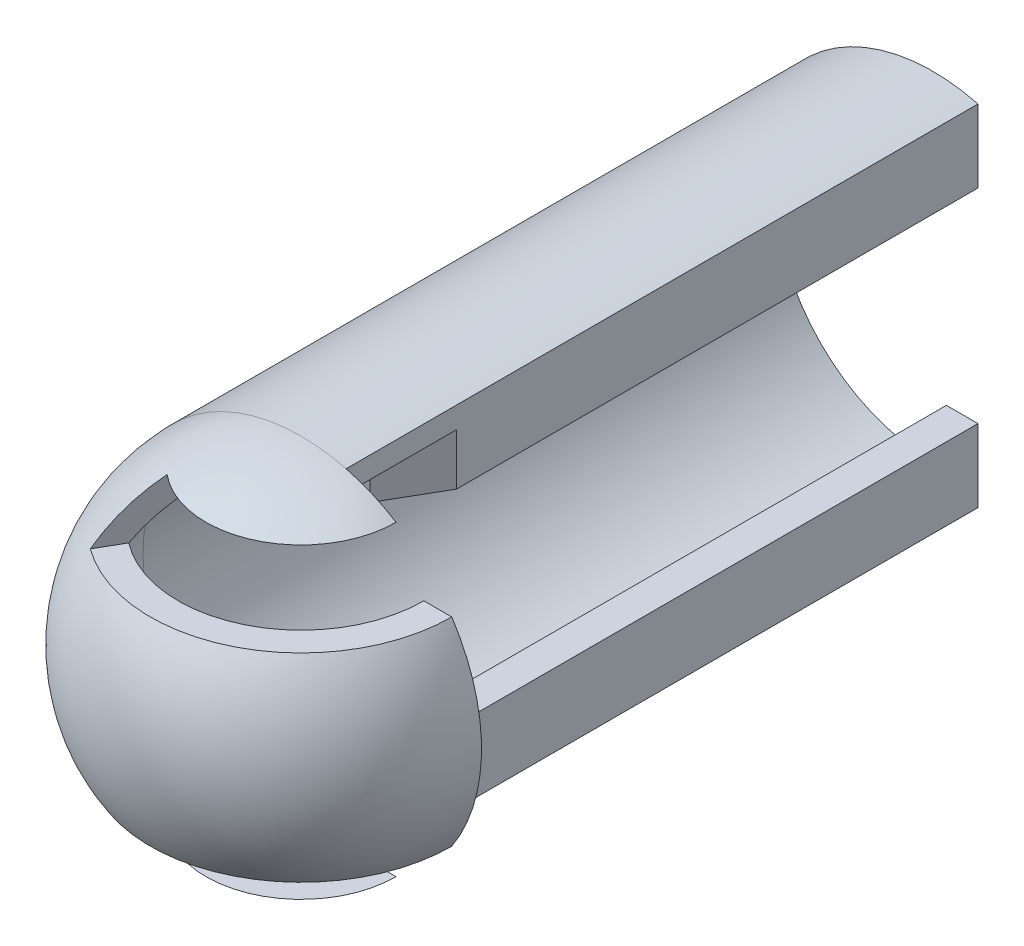
from build123d import *

# Parameters (mm, degrees)
BOSS_EXTRUDE1_DEPTH = 140
REVOLVE1_ANGLE      = 180
CUT_EXTRUDE1_START  = -6
CUT_EXTRUDE1_DEPTH  = 12


with BuildPart() as part:
    # Sketch1 → Boss-Extrude1 (new body)
    with BuildSketch(Plane.XY):
        with BuildLine():
            Line((10, 38.729833462), (10, 22.6))
            Line((10, 22.6), (3, 22.6))
            Line((3, 22.6), (3, 34.871191548))
            ThreePointArc((3, 34.871191548), (-35, 0), (3, -34.871191548))
            Line((3, -34.871191548), (3, -22.6))
            Line((3, -22.6), (10, -22.6))
            Line((10, -22.6), (10, -38.729833462))
            ThreePointArc((10, -38.729833462), (-40, 0), (10, 38.729833462))
        make_face()
    extrude(amount=-BOSS_EXTRUDE1_DEPTH)

    # Sketch6 → Revolve1 (revolve)
    with BuildSketch(Plane.XY):
        with BuildLine():
            Line((0, 35), (0, 40))
            ThreePointArc((0, 40), (-40, 0), (0, -40))
            Line((0, -40), (0, -35))
            ThreePointArc((0, -35), (-35, 0), (0, 35))
        make_face()
    revolve(axis=Axis((0, 40, 0), (0, 1, 0)), revolution_arc=REVOLVE1_ANGLE)

    # Sketch2 → Cut-Extrude1 (cut)
    with BuildSketch(Plane(origin=(0, 40, 0), x_dir=(1, 0, 0), z_dir=(0, 1, 0)).offset(CUT_EXTRUDE1_START)):
        with BuildLine():
            ThreePointArc((-23.009159547, -32.719697079), (34.641016151, -20), (16.831509101, 36.286365227))
            Line((16.831509101, 36.286365227), (-23.009159547, -32.719697079))
        make_face()
    cut_extrude1 = extrude(amount=-CUT_EXTRUDE1_DEPTH, mode=Mode.SUBTRACT)

    # Mirror1: Cut-Extrude1 across plane
    add(cut_extrude1.mirror(Plane.ZX), mode=Mode.SUBTRACT)


solid = part.part
